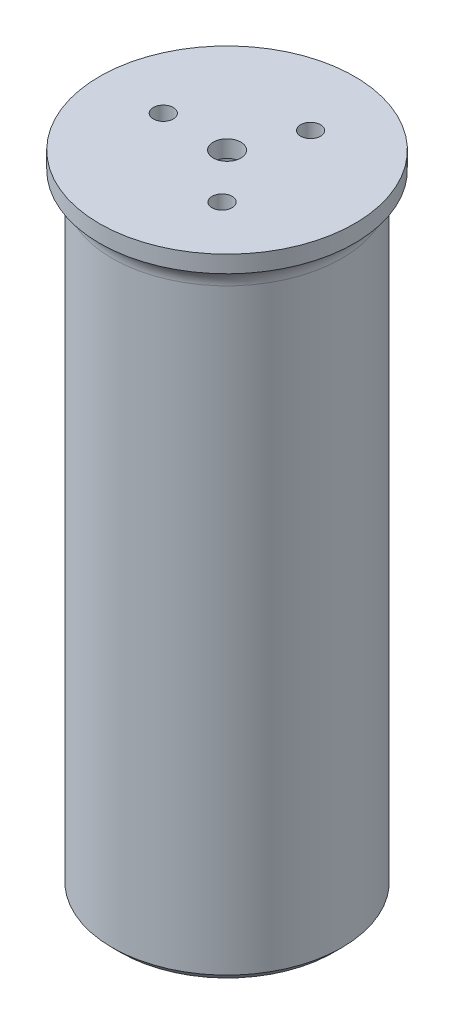
from build123d import *

# Parameters (mm, degrees)
SKETCH1_R           = 30
SKETCH1_R_2         = 2.35
BOSS_EXTRUDE1_DEPTH = 4
SKETCH2_R           = 3.25
CUT_EXTRUDE1_DEPTH  = 4
SKETCH3_R           = 27
SKETCH3_R_2         = 25
BOSS_EXTRUDE2_DEPTH = 150
CHAMFER1_SIZE       = 5
FILLET1_R           = 5


with BuildPart() as part:
    # Sketch1 → Boss-Extrude1 (new body)
    with BuildSketch(Plane(origin=(0, 0, 0), x_dir=(1, 0, 0), z_dir=(0, 1, 0))):
        with Locations(Location((0, 0, 0), (0, 0, 270))):
            Circle(SKETCH1_R)
        with Locations(Location((-15, -0.001003279, 0), (0, 0, 270))):
            Circle(SKETCH1_R_2, mode=Mode.SUBTRACT)
        with Locations(Location((5.832408968, 13.819660113, 0), (0, 0, 270))):
            Circle(SKETCH1_R_2, mode=Mode.SUBTRACT)
        with Locations(Location((10, -11.180339887, 0), (0, 0, 270))):
            Circle(SKETCH1_R_2, mode=Mode.SUBTRACT)
    extrude(amount=BOSS_EXTRUDE1_DEPTH)

    # Sketch2 → Cut-Extrude1 (cut)
    with BuildSketch(Plane(origin=(0, 4, 0), x_dir=(1, 0, 0), z_dir=(0, 1, 0))):
        with Locations(Location((0, 0, 0), (0, 0, 270))):
            Circle(SKETCH2_R)
    extrude(amount=-CUT_EXTRUDE1_DEPTH, mode=Mode.SUBTRACT)

    # Sketch3 → Boss-Extrude2 (add)
    with BuildSketch(Plane.XZ):
        with Locations(Location((0, 0, 0), (0, 0, 90))):
            Circle(SKETCH3_R)
        with Locations(Location((0, 0, 0), (0, 0, 270))):
            Circle(SKETCH3_R_2, mode=Mode.SUBTRACT)
    extrude(amount=BOSS_EXTRUDE2_DEPTH)

    # Chamfer1
    # the kernel refuses this chamfer: 5 mm, written as the material it takes off along each edge
    with BuildSketch(Plane(origin=(0, -150, 0), x_dir=(0, 0, 1), z_dir=(1, 0, 0))) as chamfer1_piece_1:
        Polygon((27, -CHAMFER1_SIZE), (27 - CHAMFER1_SIZE, 0), (27, 0), align=None)
    revolve(axis=Axis((0, -150, 0), (0, -1, 0)), mode=Mode.SUBTRACT)

    # Fillet1
    # the kernel refuses this fillet: 5 mm, written as the material it adds along each edge
    with BuildSketch(Plane(origin=(0, 0, 0), x_dir=(0, 0, 1), z_dir=(1, 0, 0))) as fillet1_piece_1:
        with BuildLine():
            CenterArc((32, 4.582575695), FILLET1_R, 180, 66.421821522)
            Line((27, 4.582575695), (26.9, 4.582575695))
            Line((26.9, 4.582575695), (26.9, 0))
            Line((26.9, 0), (27, -0.1))
            ThreePointArc((27, -0.1), (28.5, -0.1), (29.96, -0.091651514))
            Line((29.96, -0.091651514), (30, 0))
        make_face()
    revolve(axis=Axis((0, 0, 0), (0, -1, 0)))


solid = part.part
